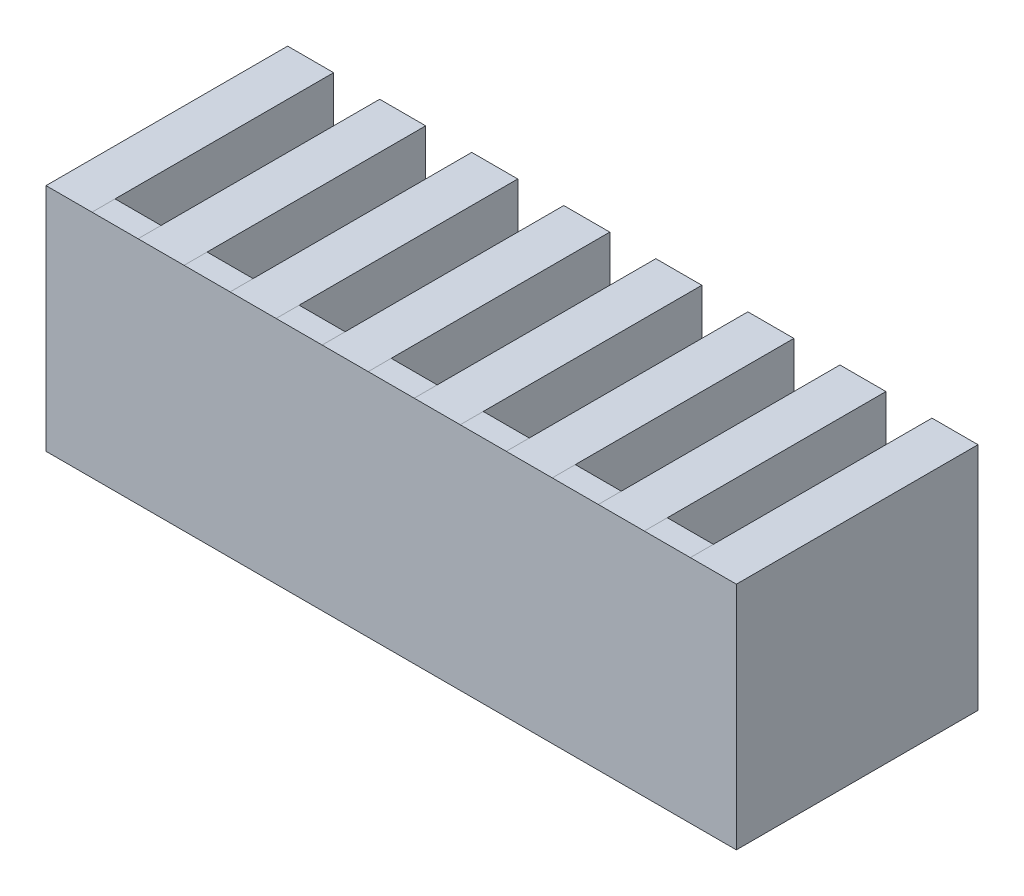
from build123d import *

# Parameters (mm, degrees)
SKETCH1_W           = 30
SKETCH1_H           = 10
BOSS_EXTRUDE1_DEPTH = 10.5
CUT_EXTRUDE1_DEPTH  = 34.320414163
LPATTERN1_COUNT     = 13
LPATTERN1_PITCH     = 2


with BuildPart() as part:
    # Sketch1 → Boss-Extrude1 (new body)
    with BuildSketch(Plane.XY):
        with Locations((15, 5)):
            Rectangle(SKETCH1_W, SKETCH1_H)
    extrude(amount=BOSS_EXTRUDE1_DEPTH)

    # Sketch3 → Cut-Extrude1 (cut, symmetric)
    with BuildSketch(Plane.XZ):
        Polygon((2, -69.808026217), (2, 0), (2, 9.5), (4, 9.5), (4, 0), (4, -69.808026217), (4, -209.424078652), (2, -209.424078652), align=None)
    cut_extrude1 = extrude(amount=CUT_EXTRUDE1_DEPTH, both=True, mode=Mode.SUBTRACT)

    # LPattern1: Cut-Extrude1 ×13, 6 skipped
    with Locations(*[(i * LPATTERN1_PITCH, 0, 0) for i in range(1, LPATTERN1_COUNT) if i not in (1, 3, 5, 7, 9, 11)]):
        add(cut_extrude1, mode=Mode.SUBTRACT)


solid = part.part
